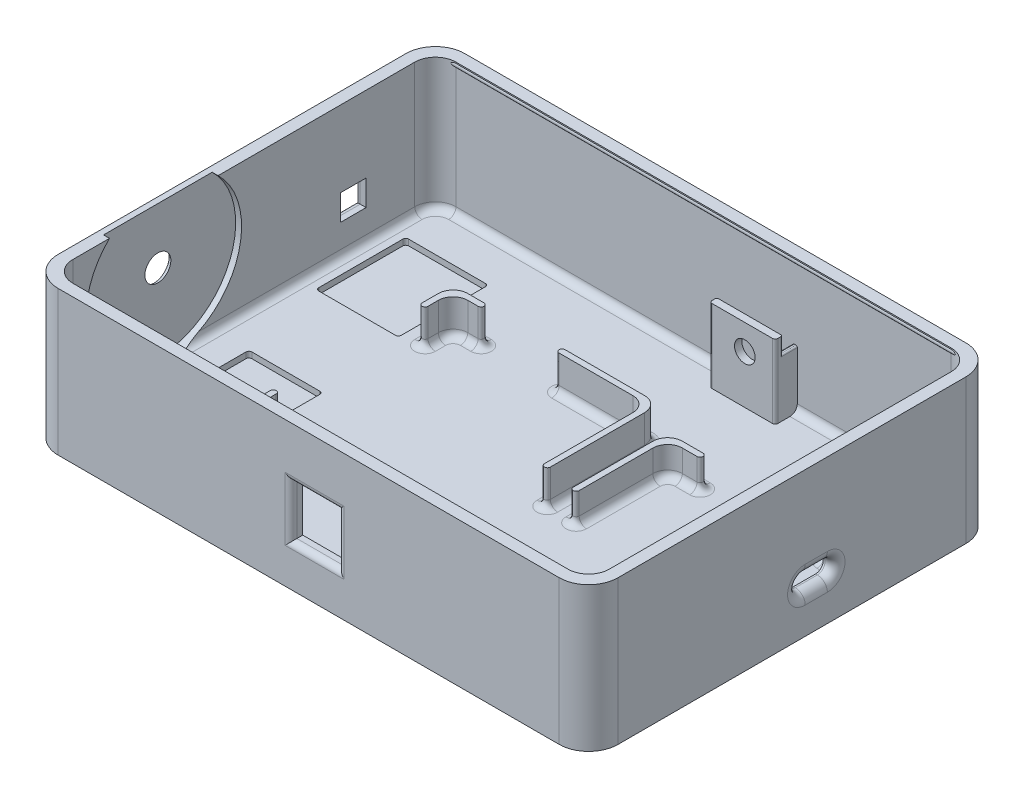
from build123d import *

# Parameters (mm, degrees)
SKETCH1_W                = 190
SKETCH1_H                = 138
SKETCH1_W_2              = 182
SKETCH1_H_2              = 130
BOX_SIDES_DEPTH          = 45
FILLET1_R                = 7
FILLET2_R                = 10
BOTTOM_DEPTH             = 4
CAMERA_HOLES_REACH       = 209.089
SKETCH3_R                = 4.35
SKETCH3_W                = 8.7
SKETCH3_H                = 8.7
BATTERY_CAGE_DEPTH       = 10
PI_CAGE_DEPTH            = 12
FILLET3_R                = 5
FILLET4_R                = 2.5
POWER_BUTTON_REACH       = 209.089
FILLET5_R                = 3.4
USBS_REACH               = 175.476
SKETCH15_W               = 16
SKETCH15_H               = 17.5
FILLET6_R                = 2
FILLET9_R                = 2
SKETCH19_W               = 28
SKETCH19_H               = 30.5
SKETCH19_W_2             = 25
CAM_MOUNTS_DEPTH         = 2
SKETCH17_W               = 1.5
SKETCH17_H               = 2.5
BUTTON_MOUNT_DEPTH       = 25
SKETCH16_R               = 3.5
BUTTON_HOLE_DEPTH        = 20
FILLET11_R               = 3
FILLET12_R               = 1
SKETCH20_W               = 1.5
SKETCH20_H               = 5
BUTTON_SUPPORTS_DEPTH    = 5.5
FILLET13_R               = 0.5
LID_START                = -85.600313
LID_RIDGE_DEPTH          = 171.200626
HOLDER_INSERT_DEPTH      = 14
HOLDER_INSERT_DEPTH_BACK = 2.01
SKETCH22_R               = 4.35


with BuildPart() as part:
    # Sketch1 → Box Sides (new body)
    with BuildSketch(Plane(origin=(0, 0, 0), x_dir=(1, 0, 0), z_dir=(0, 1, 0))):
        Rectangle(SKETCH1_W, SKETCH1_H)
        Rectangle(SKETCH1_W_2, SKETCH1_H_2, mode=Mode.SUBTRACT)
    extrude(amount=BOX_SIDES_DEPTH)

    # Fillet1
    fillet1_edges = [part.edges().sort_by_distance(p)[0] for p in [
        (91, 22.5, 65),
        (91, 22.5, -65),
        (-91, 22.5, -65),
        (-91, 22.5, 65),
    ]]
    fillet(fillet1_edges, radius=FILLET1_R)

    # Fillet2
    fillet2_edges = [part.edges().sort_by_distance(p)[0] for p in [
        (-95, 22.5, 69),
        (-95, 22.5, -69),
        (95, 22.5, -69),
        (95, 22.5, 69),
    ]]
    fillet(fillet2_edges, radius=FILLET2_R)

    # Sketch2 → Bottom (add)
    # profile 1 of 2: a face of its own
    with BuildSketch(Plane.XZ):
        with BuildLine():
            ThreePointArc((-95, -59), (-92.071067812, -66.071067812), (-85, -69))
            Line((-85, -69), (85, -69))
            ThreePointArc((85, -69), (92.071067812, -66.071067812), (95, -59))
            Line((95, -59), (95, 59))
            ThreePointArc((95, 59), (92.071067812, 66.071067812), (85, 69))
            Line((85, 69), (-85, 69))
            ThreePointArc((-85, 69), (-92.071067812, 66.071067812), (-95, 59))
            Line((-95, 59), (-95, -59))
        make_face()
        with BuildLine():
            ThreePointArc((-91, 58), (-88.949747468, 62.949747468), (-84, 65))
            Line((-84, 65), (84, 65))
            ThreePointArc((84, 65), (88.949747468, 62.949747468), (91, 58))
            Line((91, 58), (91, -58))
            ThreePointArc((91, -58), (88.949747468, -62.949747468), (84, -65))
            Line((84, -65), (-84, -65))
            ThreePointArc((-84, -65), (-88.949747468, -62.949747468), (-91, -58))
            Line((-91, -58), (-91, 58))
        make_face(mode=Mode.SUBTRACT)
    # profile 2 of 2: a face of its own
    with BuildSketch(Plane.XZ):
        with BuildLine():
            Line((-84, 65), (84, 65))
            ThreePointArc((84, 65), (88.949747468, 62.949747468), (91, 58))
            Line((91, 58), (91, -58))
            ThreePointArc((91, -58), (88.949747468, -62.949747468), (84, -65))
            Line((84, -65), (-84, -65))
            ThreePointArc((-84, -65), (-88.949747468, -62.949747468), (-91, -58))
            Line((-91, -58), (-91, 58))
            ThreePointArc((-91, 58), (-88.949747468, 62.949747468), (-84, 65))
        make_face()
    extrude(amount=BOTTOM_DEPTH)

    # Sketch3 → Camera Holes (cut, up to next)
    with BuildSketch(Plane.ZY.offset(95), mode=Mode.PRIVATE) as camera_holes_sk1:
        with Locations((27.15, 26.1)):
            Circle(SKETCH3_R)
    camera_holes_tool1 = extrude(camera_holes_sk1.sketch, amount=-CAMERA_HOLES_REACH, mode=Mode.PRIVATE) & part.part
    # Sketch3 → Camera Holes (cut, up to next)
    with BuildSketch(Plane.ZY.offset(95), mode=Mode.PRIVATE) as camera_holes_sk2:
        with Locations((-37.15, 14.85)):
            Rectangle(SKETCH3_W, SKETCH3_H)
    camera_holes_tool2 = extrude(camera_holes_sk2.sketch, amount=-CAMERA_HOLES_REACH, mode=Mode.PRIVATE) & part.part
    add(camera_holes_tool1.solids().sort_by_distance((-95, 26.1, 27.15))[0], mode=Mode.SUBTRACT)
    add(camera_holes_tool2.solids().sort_by_distance((-95, 14.85, -37.15))[0], mode=Mode.SUBTRACT)

    # Sketch4 → Battery Cage (add)
    with BuildSketch(Plane(origin=(0, 0, 0), x_dir=(1, 0, 0), z_dir=(0, 1, 0))):
        with BuildLine():
            ThreePointArc((27.8, -5), (26.8, -6), (25.8, -5))
            Line((25.8, -5), (25.8, 27))
            Line((25.8, 27), (37.8, 27))
            ThreePointArc((37.8, 27), (38.8, 26), (37.8, 25))
            Line((37.8, 25), (27.8, 25))
            Line((27.8, 25), (27.8, -5))
        make_face()
        with BuildLine():
            Line((91, 27), (81, 27))
            ThreePointArc((81, 27), (80, 26), (81, 25))
            Line((81, 25), (91, 25))
            Line((91, 25), (91, 27))
        make_face()
        with BuildLine():
            Line((25.8, -65), (27.8, -65))
            Line((27.8, -65), (27.8, -35))
            ThreePointArc((27.8, -35), (26.8, -34), (25.8, -35))
            Line((25.8, -35), (25.8, -65))
        make_face()
    extrude(amount=BATTERY_CAGE_DEPTH)

    # Sketch5 → Pi Cage (add)
    with BuildSketch(Plane(origin=(0, 0, 0), x_dir=(1, 0, 0), z_dir=(0, 1, 0))):
        with BuildLine():
            Line((16, -65), (16, -35))
            ThreePointArc((16, -35), (17, -34), (18, -35))
            Line((18, -35), (18, -65))
            Line((18, -65), (16, -65))
        make_face()
        with BuildLine():
            Line((16, 30), (16, -5))
            ThreePointArc((16, -5), (17, -6), (18, -5))
            Line((18, -5), (18, 32))
            Line((18, 32), (-14, 32))
            ThreePointArc((-14, 32), (-15, 31), (-14, 30))
            Line((-14, 30), (16, 30))
        make_face()
        with BuildLine():
            Line((-41.5, 30), (-50, 30))
            Line((-50, 30), (-50, 21.5))
            ThreePointArc((-50, 21.5), (-51, 20.5), (-52, 21.5))
            Line((-52, 21.5), (-52, 32))
            Line((-52, 32), (-41.5, 32))
            ThreePointArc((-41.5, 32), (-40.5, 31), (-41.5, 30))
        make_face()
        with BuildLine():
            Line((-52, -65), (-52, -30))
            ThreePointArc((-52, -30), (-51, -29), (-50, -30))
            Line((-50, -30), (-50, -65))
            Line((-50, -65), (-52, -65))
        make_face()
    extrude(amount=PI_CAGE_DEPTH)

    # Fillet3
    fillet3_edges = [part.edges().sort_by_distance(p)[0] for p in [
        (27.8, 5, -25),
        (25.8, 5, -27),
        (91, 5, -25),
        (27.8, 5, 65),
        (16, 6, -30),
        (18, 6, -32),
        (-52, 6, -32),
        (-50, 6, -30),
        (-50, 6, 65),
        (16, 6, 65),
    ]]
    fillet(fillet3_edges, radius=FILLET3_R)

    # Fillet4
    fillet4_edges = [part.edges().sort_by_distance(p)[0] for p in [
        (-95, 26.1, 22.8),
        (38.8, 0, -26),
        (26.8, 0, 6),
        (91, 0, -42.5),
        (86, 0, -27),
        (80, 0, -26),
        (83.5, 0, -25),
        (26.8, 0, 34),
        (25.8, 0, 50),
        (27.8, 0, 47.5),
        (17, 0, 6),
        (-15, 0, -31),
        (-44.25, 0, -32),
        (-40.5, 0, -31),
        (-43.25, 0, -30),
        (-51, 0, -20.5),
        (-52, 0, 47.5),
        (-51, 0, 29),
        (21.9, 0, 65),
        (18, 0, 50),
        (17, 0, 34),
        (-17, 0, 65),
        (58.4, 0, 65),
        (-50, 0, -23.25),
        (-52, 0, -24.25),
        (16, 0, -10),
        (-1.5, 0, -30),
        (-0.5, 0, -32),
        (18, 0, -11),
        (27.8, 0, -7.5),
        (25.8, 0, -8.5),
        (34.3, 0, -27),
        (35.3, 0, -25),
        (-50, 0, 45),
        (16, 0, 47.5),
        (29.264466094, 0, 63.535533906),
        (89.535533906, 0, -23.535533906),
        (29.264466094, 0, -23.535533906),
        (14.535533906, 0, -28.535533906),
        (-48.535533906, 0, -28.535533906),
        (-48.535533906, 0, 63.535533906),
        (14.535533906, 0, 63.535533906),
        (16.535533906, 0, -30.535533906),
        (-50.535533906, 0, -30.535533906),
        (27.264466094, 0, -25.535533906),
        (-68, 0, 65),
        (91, 0, 19),
        (0, 0, -65),
        (-91, 0, 0),
        (88.949747468, 0, 62.949747468),
        (88.949747468, 0, -62.949747468),
        (-88.949747468, 0, 62.949747468),
        (-88.949747468, 0, -62.949747468),
    ]]
    fillet(fillet4_edges, radius=FILLET4_R)

    # Sketch14 → Power Button (cut, up to next)
    with BuildSketch(Plane(origin=(95, 0, 0), x_dir=(0, 0, -1), z_dir=(1, 0, 0)), mode=Mode.PRIVATE) as power_button_sk1:
        with BuildLine():
            Line((4.5, 8.6), (12, 8.6))
            ThreePointArc((12, 8.6), (14.6, 11.2), (12, 13.8))
            Line((12, 13.8), (4.5, 13.8))
            ThreePointArc((4.5, 13.8), (1.9, 11.2), (4.5, 8.6))
        make_face()
    power_button_tool1 = extrude(power_button_sk1.sketch, amount=-POWER_BUTTON_REACH, mode=Mode.PRIVATE) & part.part
    add(power_button_tool1.solids().sort_by_distance((95, 11.2, -8.25))[0], mode=Mode.SUBTRACT)

    # Fillet5
    fillet5_edges = [part.edges().sort_by_distance(p)[0] for p in [
        (95, 13.8, -8.25),
        (95, 8.6, -8.25),
        (95, 11.2, -14.6),
        (95, 11.2, -1.9),
    ]]
    fillet(fillet5_edges, radius=FILLET5_R)

    # Sketch15 → USBs (cut, up to next)
    with BuildSketch(Plane.XY.offset(69), mode=Mode.PRIVATE) as usbs_sk1:
        with Locations((2, 18.75)):
            Rectangle(SKETCH15_W, SKETCH15_H)
    usbs_tool1 = extrude(usbs_sk1.sketch, amount=-USBS_REACH, mode=Mode.PRIVATE) & part.part
    add(usbs_tool1.solids().sort_by_distance((2, 18.75, 69))[0], mode=Mode.SUBTRACT)

    # Fillet6
    fillet6_edges = [part.edges().sort_by_distance(p)[0] for p in [
        (2, 27.5, 69),
        (10, 18.75, 69),
        (2, 10, 69),
        (-6, 18.75, 69),
    ]]
    fillet(fillet6_edges, radius=FILLET6_R)

    # Fillet9
    fillet9_edges = [part.edges().sort_by_distance(p)[0] for p in [
        (-95, 10.5, -37.15),
        (-95, 14.85, -32.8),
        (-95, 14.85, -41.5),
        (-95, 19.2, -37.15),
    ]]
    fillet(fillet9_edges, radius=FILLET9_R)

    # Sketch19 → Cam Mounts (cut)
    with BuildSketch(Plane(origin=(0, 0, 0), x_dir=(1, 0, 0), z_dir=(0, 1, 0))):
        with Locations((-72, 34.7)):
            Rectangle(SKETCH19_W, SKETCH19_H)
        with Locations((-66.96, -25.05)):
            Rectangle(SKETCH19_W_2, SKETCH19_H)
    extrude(amount=-CAM_MOUNTS_DEPTH, mode=Mode.SUBTRACT)

    # Sketch17 → Button Mount (add)
    with BuildSketch(Plane(origin=(0, 0, 0), x_dir=(1, 0, 0), z_dir=(0, 1, 0))):
        with BuildLine():
            Line((30.3, 60), (11, 60))
            Line((11, 60), (11, 62.5))
            Line((11, 62.5), (9.5, 62.5))
            Line((9.5, 62.5), (9.5, 58.4))
            ThreePointArc((9.5, 58.4), (9.763603897, 57.763603897), (10.4, 57.5))
            Line((10.4, 57.5), (11, 57.5))
            Line((11, 57.5), (30.3, 57.5))
            Line((30.3, 57.5), (30.9, 57.5))
            ThreePointArc((30.9, 57.5), (31.536396103, 57.763603897), (31.8, 58.4))
            Line((31.8, 58.4), (31.8, 62.5))
            Line((31.8, 62.5), (30.3, 62.5))
            Line((30.3, 62.5), (30.3, 60))
        make_face()
        with Locations((10.25, 63.75)):
            Rectangle(SKETCH17_W, SKETCH17_H)
        with Locations((31.05, 63.75)):
            Rectangle(SKETCH17_W, SKETCH17_H)
    extrude(amount=BUTTON_MOUNT_DEPTH)

    # Sketch16 → Button Hole (cut)
    with BuildSketch(Plane(origin=(0, 0, -69), x_dir=(-1, 0, 0), z_dir=(0, 0, -1))):
        with Locations((-21.5, 16.4)):
            Circle(SKETCH16_R)
    extrude(amount=-BUTTON_HOLE_DEPTH, mode=Mode.SUBTRACT)

    # Fillet11
    fillet11_edges = [part.edges().sort_by_distance(p)[0] for p in [
        (25, 16.4, -69),
    ]]
    fillet(fillet11_edges, radius=FILLET11_R)

    # Fillet12
    # the kernel refuses this fillet: 1 mm, written as the material it adds along each edge
    with BuildSketch(Plane(origin=(-58, 0, -19.45), x_dir=(0, 0, -1), z_dir=(0, -1, 0)), Plane(origin=(-58, 0, -49.95), x_dir=(-1, 0, 0), z_dir=(0, -1, 0)), Plane(origin=(-79.46, 0, 40.3), x_dir=(1, 0, 0), z_dir=(0, -1, 0)), Plane(origin=(-79.46, 0, 9.8), x_dir=(0, 0, 1), z_dir=(0, -1, 0)), Plane(origin=(-54.46, 0, 9.8), x_dir=(-1, 0, 0), z_dir=(0, -1, 0))) as fillet12_piece_1:
        with BuildLine():
            CenterArc((FILLET12_R, -FILLET12_R), FILLET12_R, 90, 90)
            Line((0, -FILLET12_R), (0, 0))
            Line((0, 0), (FILLET12_R, 0))
        make_face()
    extrude(amount=2)
    with BuildSketch(Plane(origin=(-86, 0, -19.45), x_dir=(0, 0, -1), z_dir=(0, -1, 0)), Plane(origin=(-86, 0, -49.95), x_dir=(1, 0, 0), z_dir=(0, -1, 0)), Plane(origin=(-54.46, 0, 40.3), x_dir=(-1, 0, 0), z_dir=(0, -1, 0))) as fillet12_piece_2:
        with BuildLine():
            CenterArc((FILLET12_R, FILLET12_R), FILLET12_R, 180, 90)
            Line((0, FILLET12_R), (0, 0))
            Line((0, 0), (FILLET12_R, 0))
        make_face()
    extrude(amount=2)

    # Sketch20 → Button Supports (cut)
    with BuildSketch(Plane(origin=(0, 25, 0), x_dir=(1, 0, 0), z_dir=(0, 1, 0))):
        with Locations((10.25, 62.5)):
            Rectangle(SKETCH20_W, SKETCH20_H)
        with Locations((31.05, 62.5)):
            Rectangle(SKETCH20_W, SKETCH20_H)
    extrude(amount=-BUTTON_SUPPORTS_DEPTH, mode=Mode.SUBTRACT)

    # Fillet13
    fillet13_edges = [part.edges().sort_by_distance(p)[0] for p in [
        (9.5, 19.5, -62.5),
        (9.5, 22.25, -60),
        (11, 19.5, -62.5),
        (30.3, 19.5, -62.5),
        (31.8, 19.5, -62.5),
        (31.8, 22.25, -60),
    ]]
    fillet(fillet13_edges, radius=FILLET13_R)

    # Sketch21 → Lid Ridge (add)
    with BuildSketch(Plane(origin=(0, 0, 0), x_dir=(0, 0, -1), z_dir=(1, 0, 0)).offset(LID_START)):
        with BuildLine():
            Line((65, 44.58), (65, 43.42))
            ThreePointArc((65, 43.42), (64.814616474, 44), (65, 44.58))
        make_face()
        with BuildLine():
            Line((-65, 44.58), (-65, 43.42))
            ThreePointArc((-65, 43.42), (-64.814616474, 44), (-65, 44.58))
        make_face()
    extrude(amount=LID_RIDGE_DEPTH)

    # Sketch22 → Holder Insert (cut, two sides: drawn at the far end of the back side and taken through both)
    # profile 1 of 3: a face of its own
    with BuildSketch(Plane(origin=(-91, 0, 0), x_dir=(0, 0, -1), z_dir=(1, 0, 0)).offset(-HOLDER_INSERT_DEPTH_BACK)):
        with BuildLine():
            Line((-8.717691409, 45), (-45.582308591, 45))
            ThreePointArc((-45.582308591, 45), (-53.237295916, 22.048704925), (-38.982159566, 2.5))
            Line((-38.982159566, 2.5), (-15.317840434, 2.5))
            ThreePointArc((-15.317840434, 2.5), (-4.685260823, 12.232934927), (-0.75, 26.1))
            ThreePointArc((-0.75, 26.1), (-2.823338219, 36.355414501), (-8.717691409, 45))
        make_face()
        with Locations((-27.15, 26.1)):
            Circle(SKETCH22_R, mode=Mode.SUBTRACT)
    # profile 2 of 3: a face of its own
    with BuildSketch(Plane(origin=(-91, 0, 0), x_dir=(0, 0, -1), z_dir=(1, 0, 0)).offset(-HOLDER_INSERT_DEPTH_BACK)):
        with BuildLine():
            ThreePointArc((-8.717691409, 45), (-27.15, 52.5), (-45.582308591, 45))
            Line((-45.582308591, 45), (-8.717691409, 45))
        make_face()
    # profile 3 of 3: a face of its own
    with BuildSketch(Plane(origin=(-91, 0, 0), x_dir=(0, 0, -1), z_dir=(1, 0, 0)).offset(-HOLDER_INSERT_DEPTH_BACK)):
        with BuildLine():
            Line((-15.317840434, 2.5), (-38.982159566, 2.5))
            ThreePointArc((-38.982159566, 2.5), (-27.15, -0.3), (-15.317840434, 2.5))
        make_face()
    extrude(amount=HOLDER_INSERT_DEPTH + HOLDER_INSERT_DEPTH_BACK, mode=Mode.SUBTRACT)


solid = part.part
